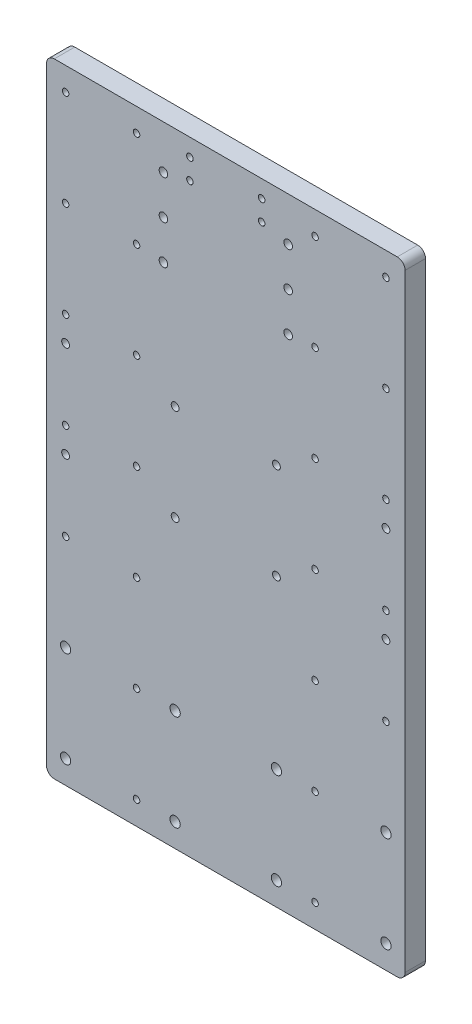
from build123d import *

# Parameters (mm, degrees)
SKETCH1_W           = 230
SKETCH1_H           = 400
BOSS_EXTRUDE1_DEPTH = 13.1
FILLET1_R           = 5
SKETCH2_R           = 2.1
CUT_EXTRUDE1_DEPTH  = 232.077065067
SKETCH3_R           = 2.75
CUT_EXTRUDE2_DEPTH  = 232.077065067
SKETCH4_R           = 2.1
SKETCH4_R_2         = 3.3
CUT_EXTRUDE3_DEPTH  = 232.077065067
SKETCH6_R           = 3.3
SKETCH6_R_2         = 2.5
CUT_EXTRUDE4_DEPTH  = 232.077065067


with BuildPart() as part:
    # Sketch1 → Boss-Extrude1 (new body)
    with BuildSketch(Plane.XY):
        Rectangle(SKETCH1_W, SKETCH1_H)
    extrude(amount=BOSS_EXTRUDE1_DEPTH)

    # Fillet1
    fillet1_edges = [part.edges().sort_by_distance(p)[0] for p in [
        (-115, 200, 6.55),
        (115, -200, 6.55),
        (-115, -200, 6.55),
        (115, 200, 6.55),
    ]]
    fillet(fillet1_edges, radius=FILLET1_R)

    # Sketch2 → Cut-Extrude1 (cut, through all)
    with BuildSketch(Plane.XY.offset(13.1)):
        with Locations((-23, 188.85)):
            Circle(SKETCH2_R)
        with Locations((23, 188.85)):
            Circle(SKETCH2_R)
        with Locations((23, 175.85)):
            Circle(SKETCH2_R)
        with Locations((-23, 175.85)):
            Circle(SKETCH2_R)
    extrude(amount=-CUT_EXTRUDE1_DEPTH, mode=Mode.SUBTRACT)

    # Sketch3 → Cut-Extrude2 (cut, through all)
    with BuildSketch(Plane(origin=(0, 0, 0), x_dir=(-1, 0, 0), z_dir=(0, 0, -1))):
        with Locations((-40, 121.986509201)):
            Circle(SKETCH3_R)
        with Locations((-40, 146.986509201)):
            Circle(SKETCH3_R)
        with Locations((-40, 171.986509201)):
            Circle(SKETCH3_R)
        with Locations((40, 121.986509201)):
            Circle(SKETCH3_R)
        with Locations((40, 146.986509201)):
            Circle(SKETCH3_R)
        with Locations((40, 171.986509201)):
            Circle(SKETCH3_R)
    extrude(amount=-CUT_EXTRUDE2_DEPTH, mode=Mode.SUBTRACT)

    # Sketch4 → Cut-Extrude3 (cut, through all)
    with BuildSketch(Plane.XY.offset(13.1)):
        with Locations((-102.75, 185)):
            Circle(SKETCH4_R)
        with Locations((-102.75, 123.333333333)):
            Circle(SKETCH4_R)
        with Locations((-102.75, 61.666666667)):
            Circle(SKETCH4_R)
        with Locations((-102.75, 0)):
            Circle(SKETCH4_R)
        with Locations((-102.75, -61.666666667)):
            Circle(SKETCH4_R)
        with Locations((-102.75, -123.333333333)):
            Circle(SKETCH4_R_2)
        with Locations((-102.75, -185)):
            Circle(SKETCH4_R_2)
        with Locations((-57.25, 185)):
            Circle(SKETCH4_R)
        with Locations((-57.25, 123.333333333)):
            Circle(SKETCH4_R)
        with Locations((-57.25, 61.666666667)):
            Circle(SKETCH4_R)
        with Locations((-57.25, 0)):
            Circle(SKETCH4_R)
        with Locations((-57.25, -61.666666667)):
            Circle(SKETCH4_R)
        with Locations((-57.25, -123.333333333)):
            Circle(SKETCH4_R)
        with Locations((-57.25, -185)):
            Circle(SKETCH4_R)
        with Locations((57.25, -185)):
            Circle(SKETCH4_R)
        with Locations((57.25, -123.333333333)):
            Circle(SKETCH4_R)
        with Locations((57.25, -61.666666667)):
            Circle(SKETCH4_R)
        with Locations((57.25, 0)):
            Circle(SKETCH4_R)
        with Locations((57.25, 61.666666667)):
            Circle(SKETCH4_R)
        with Locations((57.25, 123.333333333)):
            Circle(SKETCH4_R)
        with Locations((57.25, 185)):
            Circle(SKETCH4_R)
        with Locations((102.75, -185)):
            Circle(SKETCH4_R_2)
        with Locations((102.75, -123.333333333)):
            Circle(SKETCH4_R_2)
        with Locations((102.75, -61.666666667)):
            Circle(SKETCH4_R)
        with Locations((102.75, 0)):
            Circle(SKETCH4_R)
        with Locations((102.75, 61.666666667)):
            Circle(SKETCH4_R)
        with Locations((102.75, 123.333333333)):
            Circle(SKETCH4_R)
        with Locations((102.75, 185)):
            Circle(SKETCH4_R)
    extrude(amount=-CUT_EXTRUDE3_DEPTH, mode=Mode.SUBTRACT)

    # Sketch6 → Cut-Extrude4 (cut, through all)
    with BuildSketch(Plane.XY.offset(13.1)):
        with Locations((32.5, -123.333333333)):
            Circle(SKETCH6_R)
        with Locations((-32.5, -123.333333333)):
            Circle(SKETCH6_R)
        with Locations((-32.5, -185)):
            Circle(SKETCH6_R)
        with Locations((32.5, -185)):
            Circle(SKETCH6_R)
        with Locations((102.75, 45.586666667)):
            Circle(SKETCH6_R_2)
        with Locations((102.75, -16.08)):
            Circle(SKETCH6_R_2)
        with Locations((-102.75, -16.08)):
            Circle(SKETCH6_R_2)
        with Locations((-102.75, 45.586666667)):
            Circle(SKETCH6_R_2)
        with Locations((32.5, 45.586666667)):
            Circle(SKETCH6_R_2)
        with Locations((32.5, -16.08)):
            Circle(SKETCH6_R_2)
        with Locations((-32.5, -16.08)):
            Circle(SKETCH6_R_2)
        with Locations((-32.5, 45.586666667)):
            Circle(SKETCH6_R_2)
    extrude(amount=-CUT_EXTRUDE4_DEPTH, mode=Mode.SUBTRACT)


solid = part.part
